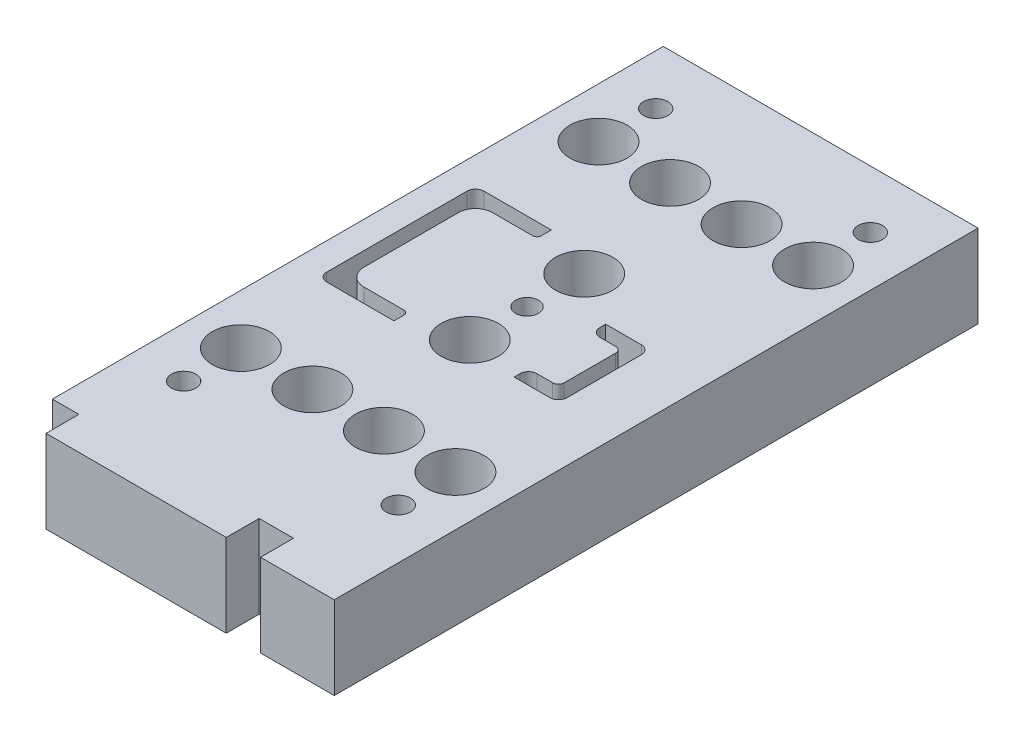
from build123d import *

# Parameters (mm, degrees)
SKETCH1_W           = 110
SKETCH1_H           = 225
BOSS_EXTRUDE1_DEPTH = 29
CUT_EXTRUDE1_REACH  = 130.539
CUT_EXTRUDE2_REACH  = 130.539
SKETCH4_R           = 8.5
CUT_EXTRUDE3_DEPTH  = 5
SKETCH5_R           = 10
CUT_EXTRUDE4_DEPTH  = 17
CUT_EXTRUDE5_REACH  = 130.539
SKETCH6_W           = 12
SKETCH6_H           = 11.5
M10_TAPPED_HOLE1_D  = 8.5
CUT_EXTRUDE6_REACH  = 130.539
SKETCH10_R          = 4


with BuildPart() as part:
    # Sketch1 → Boss-Extrude1 (new body)
    with BuildSketch(Plane(origin=(0, 0, 0), x_dir=(1, 0, 0), z_dir=(0, 1, 0))):
        Rectangle(SKETCH1_W, SKETCH1_H)
    extrude(amount=-BOSS_EXTRUDE1_DEPTH)

    # Sketch2 → Cut-Extrude1 (cut, up to next)
    with BuildSketch(Plane(origin=(0, 0, 0), x_dir=(1, 0, 0), z_dir=(0, 1, 0)), mode=Mode.PRIVATE) as cut_extrude1_sk1:
        with BuildLine():
            Line((-19, 37.36), (-19, 33.86))
            ThreePointArc((-19, 33.86), (-19.439339828, 32.799339828), (-20.5, 32.36))
            Line((-20.5, 32.36), (-34.5, 32.36))
            ThreePointArc((-34.5, 32.36), (-38.742640687, 30.602640687), (-40.5, 26.36))
            Line((-40.5, 26.36), (-40.5, -6.64))
            ThreePointArc((-40.5, -6.64), (-38.742640687, -10.882640687), (-34.5, -12.64))
            Line((-34.5, -12.64), (-20.5, -12.64))
            ThreePointArc((-20.5, -12.64), (-19.439339828, -13.079339828), (-19, -14.14))
            Line((-19, -14.14), (-19, -17.64))
            Line((-19, -17.64), (-42.5, -17.64))
            ThreePointArc((-42.5, -17.64), (-44.621320344, -16.761320344), (-45.5, -14.64))
            Line((-45.5, -14.64), (-45.5, 34.36))
            ThreePointArc((-45.5, 34.36), (-44.621320344, 36.481320344), (-42.5, 37.36))
            Line((-42.5, 37.36), (-19, 37.36))
        make_face()
    cut_extrude1_tool1 = extrude(cut_extrude1_sk1.sketch, amount=-CUT_EXTRUDE1_REACH, mode=Mode.PRIVATE) & part.part
    add(cut_extrude1_tool1.solids().sort_by_distance((-19.610512, 0, -35.61))[0], mode=Mode.SUBTRACT)

    # Sketch3 → Cut-Extrude2 (cut, up to next)
    with BuildSketch(Plane(origin=(0, 0, 0), x_dir=(1, 0, 0), z_dir=(0, 1, 0)), mode=Mode.PRIVATE) as cut_extrude2_sk1:
        with BuildLine():
            Line((19, 18.36), (31.5, 18.36))
            ThreePointArc((31.5, 18.36), (33.621320344, 17.481320344), (34.5, 15.36))
            Line((34.5, 15.36), (34.5, -10.64))
            ThreePointArc((34.5, -10.64), (33.621320344, -12.761320344), (31.5, -13.64))
            Line((31.5, -13.64), (19, -13.64))
            Line((19, -13.64), (19, -11.64))
            ThreePointArc((19, -11.64), (19.878679656, -9.518679656), (22, -8.64))
            Line((22, -8.64), (27.5, -8.64))
            ThreePointArc((27.5, -8.64), (28.914213562, -8.054213562), (29.5, -6.64))
            Line((29.5, -6.64), (29.5, 11.36))
            ThreePointArc((29.5, 11.36), (28.914213562, 12.774213562), (27.5, 13.36))
            Line((27.5, 13.36), (22, 13.36))
            ThreePointArc((22, 13.36), (19.878679656, 14.238679656), (19, 16.36))
            Line((19, 16.36), (19, 18.36))
        make_face()
    cut_extrude2_tool1 = extrude(cut_extrude2_sk1.sketch, amount=-CUT_EXTRUDE2_REACH, mode=Mode.PRIVATE) & part.part
    add(cut_extrude2_tool1.solids().sort_by_distance((25.25, 0, -18.004437))[0], mode=Mode.SUBTRACT)

    # Sketch4 → Cut-Extrude3 (cut)
    with BuildSketch(Plane.XZ.offset(29)):
        with Locations((0, 100)):
            Circle(SKETCH4_R)
        with Locations((0, -100)):
            Circle(SKETCH4_R)
    extrude(amount=-CUT_EXTRUDE3_DEPTH, mode=Mode.SUBTRACT)

    # Sketch5 → Cut-Extrude4 (cut)
    with BuildSketch(Plane(origin=(0, 0, 0), x_dir=(1, 0, 0), z_dir=(0, 1, 0))):
        with Locations((-37.5, 72.36)):
            Circle(SKETCH5_R)
        with Locations((-12.5, 72.36)):
            Circle(SKETCH5_R)
        with Locations((12.5, 72.36)):
            Circle(SKETCH5_R)
        with Locations((37.5, 72.36)):
            Circle(SKETCH5_R)
        with Locations((37.5, -52.64)):
            Circle(SKETCH5_R)
        with Locations((12.5, -52.64)):
            Circle(SKETCH5_R)
        with Locations((-12.5, -52.64)):
            Circle(SKETCH5_R)
        with Locations((-37.5, -52.64)):
            Circle(SKETCH5_R)
        with Locations((0, 29.86)):
            Circle(SKETCH5_R)
        with Locations((0, -10.14)):
            Circle(SKETCH5_R)
    extrude(amount=-CUT_EXTRUDE4_DEPTH, mode=Mode.SUBTRACT)

    # Sketch6 → Cut-Extrude5 (cut, up to next)
    with BuildSketch(Plane(origin=(0, 0, 0), x_dir=(1, 0, 0), z_dir=(0, 1, 0)), mode=Mode.PRIVATE) as cut_extrude5_sk1:
        with Locations((23.25, -106.75)):
            Rectangle(SKETCH6_W, SKETCH6_H)
    cut_extrude5_tool1 = extrude(cut_extrude5_sk1.sketch, amount=-CUT_EXTRUDE5_REACH, mode=Mode.PRIVATE) & part.part
    # Sketch6 → Cut-Extrude5 (cut, up to next)
    with BuildSketch(Plane(origin=(0, 0, 0), x_dir=(1, 0, 0), z_dir=(0, 1, 0)), mode=Mode.PRIVATE) as cut_extrude5_sk2:
        with Locations((-51.75, -106.75)):
            Rectangle(SKETCH6_W, SKETCH6_H)
    cut_extrude5_tool2 = extrude(cut_extrude5_sk2.sketch, amount=-CUT_EXTRUDE5_REACH, mode=Mode.PRIVATE) & part.part
    add(cut_extrude5_tool1.solids().sort_by_distance((23.25, 0, 106.75))[0], mode=Mode.SUBTRACT)
    add(cut_extrude5_tool2.solids().sort_by_distance((-51.75, 0, 106.75))[0], mode=Mode.SUBTRACT)

    # M10 Tapped Hole1 (through all)
    with Locations(Plane(origin=(0, 0, 0), x_dir=(1, 0, 0), z_dir=(0, 1, 0))):
        with Locations((-37.5, -72.64), (37.5, -72.64), (37.5, 92.36), (-37.5, 92.36)):
            Hole(M10_TAPPED_HOLE1_D / 2)

    # Sketch10 → Cut-Extrude6 (cut, up to next)
    with BuildSketch(Plane(origin=(0, 0, 0), x_dir=(1, 0, 0), z_dir=(0, 1, 0)), mode=Mode.PRIVATE) as cut_extrude6_sk1:
        with Locations((0, 9.86)):
            Circle(SKETCH10_R)
    cut_extrude6_tool1 = extrude(cut_extrude6_sk1.sketch, amount=-CUT_EXTRUDE6_REACH, mode=Mode.PRIVATE) & part.part
    add(cut_extrude6_tool1.solids().sort_by_distance((0, 0, -9.86))[0], mode=Mode.SUBTRACT)


solid = part.part
